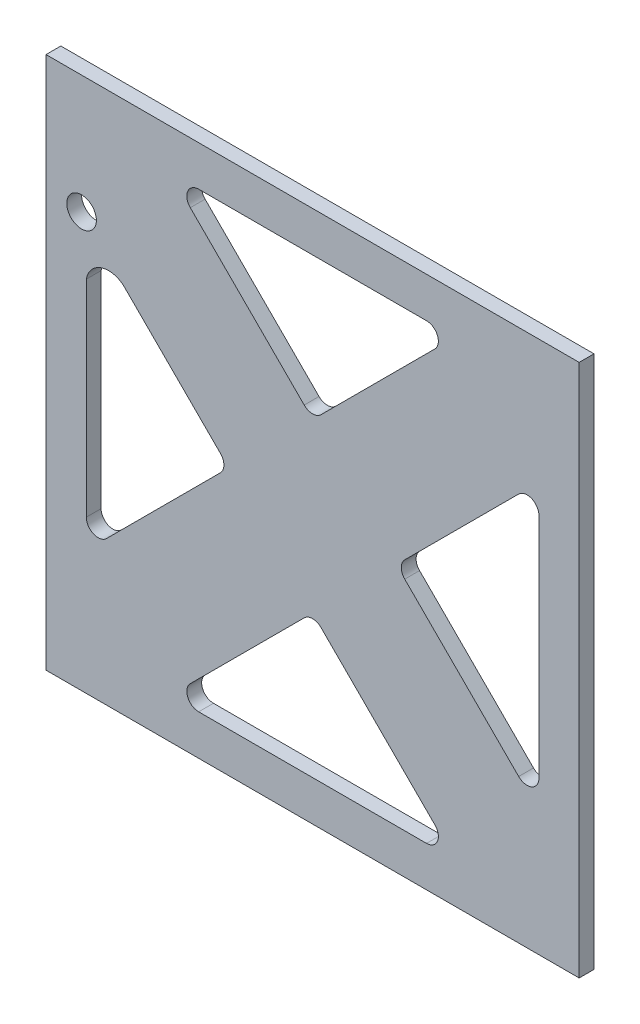
from build123d import *

# Parameters (mm, degrees)
SKETCH1_W           = 114.3
SKETCH1_H           = 114.3
SKETCH1_R           = 3.175
BOSS_EXTRUDE2_DEPTH = 1.5875


with BuildPart() as part:
    # Sketch1 → Boss-Extrude2 (new, symmetric)
    with BuildSketch(Plane.XY):
        Rectangle(SKETCH1_W, SKETCH1_H)
        with Locations((-49.53, 31.75)):
            Circle(SKETCH1_R, mode=Mode.SUBTRACT)
        with BuildLine():
            Line((-24.425187853, -48.517802544), (24.425187853, -48.517802544))
            ThreePointArc((24.425187853, -48.517802544), (26.771841866, -46.949818462), (26.221239077, -44.181751319))
            Line((26.221239077, -44.181751319), (1.796051224, -19.756563466))
            ThreePointArc((1.796051224, -19.756563466), (0, -19.012614691), (-1.796051224, -19.756563466))
            Line((-1.796051224, -19.756563466), (-26.221239077, -44.181751319))
            ThreePointArc((-26.221239077, -44.181751319), (-26.771841866, -46.949818462), (-24.425187853, -48.517802544))
        make_face(mode=Mode.SUBTRACT)
        with BuildLine():
            Line((-48.517802544, 19.756563466), (-48.517802544, -24.425187853))
            ThreePointArc((-48.517802544, -24.425187853), (-46.949818462, -26.771841866), (-44.181751319, -26.221239077))
            Line((-44.181751319, -26.221239077), (-19.756563466, -1.796051224))
            ThreePointArc((-19.756563466, -1.796051224), (-19.012614691, 0), (-19.756563466, 1.796051224))
            Line((-19.756563466, 1.796051224), (-40.426040005, 22.465527763))
            ThreePointArc((-40.426040005, 22.465527763), (-45.270847256, 23.49746294), (-48.517802544, 19.756563466))
        make_face(mode=Mode.SUBTRACT)
        with BuildLine():
            Line((24.425187853, 48.517802544), (-24.425187853, 48.517802544))
            ThreePointArc((-24.425187853, 48.517802544), (-26.771841866, 46.949818462), (-26.221239077, 44.181751319))
            Line((-26.221239077, 44.181751319), (-1.796051224, 19.756563466))
            ThreePointArc((-1.796051224, 19.756563466), (0, 19.012614691), (1.796051224, 19.756563466))
            Line((1.796051224, 19.756563466), (26.221239077, 44.181751319))
            ThreePointArc((26.221239077, 44.181751319), (26.771841866, 46.949818462), (24.425187853, 48.517802544))
        make_face(mode=Mode.SUBTRACT)
        with BuildLine():
            Line((48.517802544, -24.425187853), (48.517802544, 24.425187853))
            ThreePointArc((48.517802544, 24.425187853), (46.949818462, 26.771841866), (44.181751319, 26.221239077))
            Line((44.181751319, 26.221239077), (19.756563466, 1.796051224))
            ThreePointArc((19.756563466, 1.796051224), (19.012614691, 0), (19.756563466, -1.796051224))
            Line((19.756563466, -1.796051224), (44.181751319, -26.221239077))
            ThreePointArc((44.181751319, -26.221239077), (46.949818462, -26.771841866), (48.517802544, -24.425187853))
        make_face(mode=Mode.SUBTRACT)
    extrude(amount=BOSS_EXTRUDE2_DEPTH, both=True)


solid = part.part
